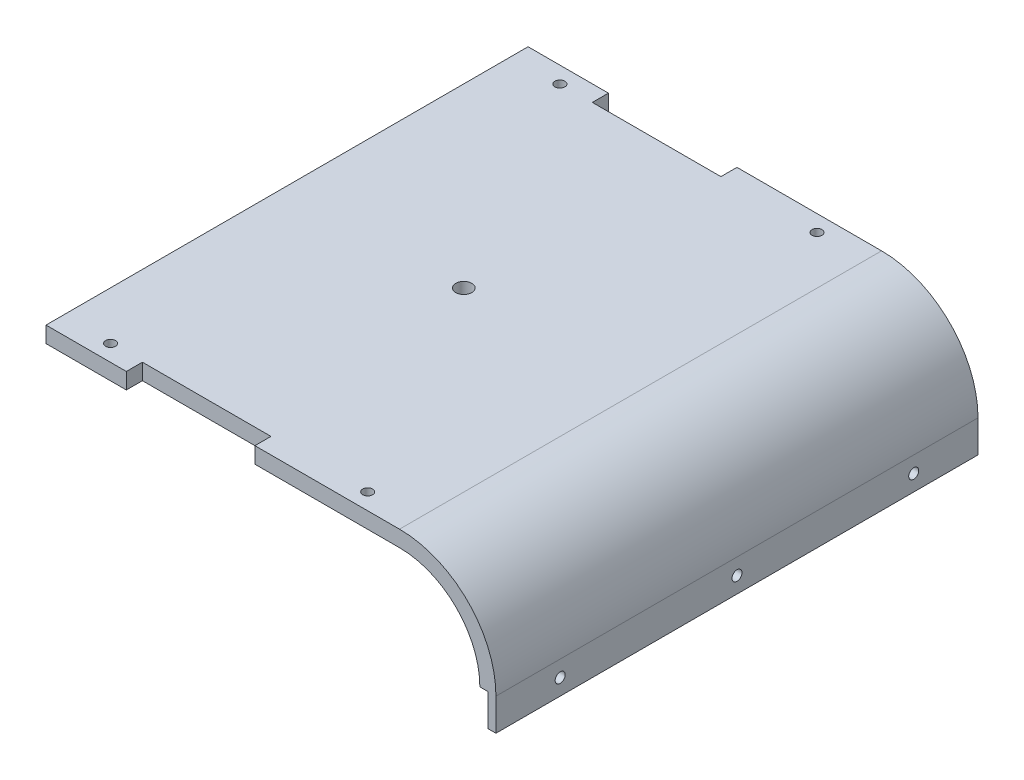
from build123d import *

# Parameters (mm, degrees)
BOSS_EXTRUDE1_DEPTH      = 190.5
BOSS_EXTRUDE1_DEPTH_BACK = 190.5
SKETCH2_W                = 6.35
SKETCH2_H                = 381
BOSS_EXTRUDE2_DEPTH      = 25.4
SKETCH3_R                = 3.96875
CUT_EXTRUDE1_DEPTH       = 25.4
SKETCH4_R                = 6.35
CUT_EXTRUDE2_DEPTH       = 17.78
SKETCH5_R                = 3.937
CUT_EXTRUDE3_DEPTH       = 306.328708116


with BuildPart() as part:
    # Sketch1 → Boss-Extrude1 (new, two sides: drawn at the far end of the back side and taken through both)
    with BuildSketch(Plane.XY.offset(-BOSS_EXTRUDE1_DEPTH_BACK)):
        with BuildLine():
            Line((-139.7, 0), (139.7, 0))
            ThreePointArc((139.7, 0), (193.581536726, -22.318463274), (215.9, -76.2))
            Line((215.9, -76.2), (203.2, -76.2))
            ThreePointArc((203.2, -76.2), (184.601280605, -31.298719395), (139.7, -12.7))
            Line((139.7, -12.7), (-139.7, -12.7))
            Line((-139.7, -12.7), (-139.7, 0))
        make_face()
    extrude(amount=BOSS_EXTRUDE1_DEPTH + BOSS_EXTRUDE1_DEPTH_BACK)

    # Sketch2 → Boss-Extrude2 (add)
    with BuildSketch(Plane.XZ.offset(76.2)):
        with Locations((212.725, 0)):
            Rectangle(SKETCH2_W, SKETCH2_H)
    extrude(amount=BOSS_EXTRUDE2_DEPTH)

    # Sketch3 → Cut-Extrude1 (cut)
    with BuildSketch(Plane(origin=(215.9, 0, 0), x_dir=(0, 0, -1), z_dir=(1, 0, 0))):
        with Locations((-139.7, -88.9)):
            Circle(SKETCH3_R)
        with Locations((0, -88.9)):
            Circle(SKETCH3_R)
        with Locations((139.7, -88.9)):
            Circle(SKETCH3_R)
    extrude(amount=-CUT_EXTRUDE1_DEPTH, mode=Mode.SUBTRACT)

    # Sketch4 → Cut-Extrude2 (cut)
    with BuildSketch(Plane(origin=(0, 0, 0), x_dir=(1, 0, 0), z_dir=(0, 1, 0))):
        Circle(SKETCH4_R)
    extrude(amount=-CUT_EXTRUDE2_DEPTH, mode=Mode.SUBTRACT)

    # Sketch5 → Cut-Extrude3 (cut, through all)
    with BuildSketch(Plane(origin=(0, 0, 0), x_dir=(1, 0, 0), z_dir=(0, 1, 0))):
        with Locations((-101.6, -177.546)):
            Circle(SKETCH5_R)
        with Locations((101.6, -177.546)):
            Circle(SKETCH5_R)
        with Locations((101.6, 177.546)):
            Circle(SKETCH5_R)
        with Locations((-101.6, 177.546)):
            Circle(SKETCH5_R)
        Polygon((0, -190.5), (-76.2, -190.5), (-76.2, -177.8), (0, -177.8), (25.4, -177.8), (25.4, -190.5), align=None)
        Polygon((25.4, 177.8), (25.4, 190.5), (0, 190.5), (-76.2, 190.5), (-76.2, 177.8), (0, 177.8), align=None)
    extrude(amount=-CUT_EXTRUDE3_DEPTH, mode=Mode.SUBTRACT)


solid = part.part
